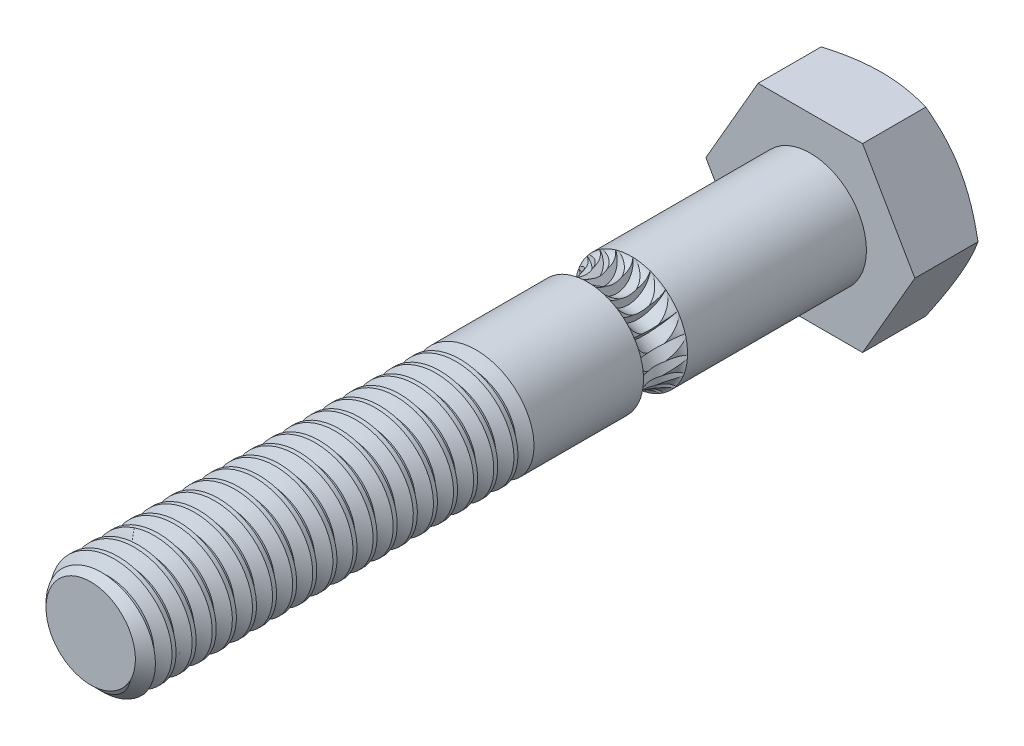
from build123d import *

# Parameters (mm, degrees)
SKETCH1_R             = 3.937
BOLT_BODY_DEPTH       = 50.5
BOLT_TIP_CHAMFER_SIZE = 0.8
CUT_SWEEP1_PITCH      = 1.411111111
BOLT_HEAD_DEPTH       = 5
SKETCH6_OUTSIDE_W     = 63.064
SKETCH6_OUTSIDE_H     = 61.1
SKETCH6_OUTSIDE_R     = 6.35
HEAD_CIRCLE_DEPTH     = 10
HEAD_CIRCLE_DRAFT     = -60
WAIST_CUT_CONTOUR_R   = 1.5875
TOOTH_CUT_CONTOUR_R   = 1.5875
TOOTH_CUT_DEPTH       = 52.601249437
TOOTH_X20_COUNT       = 20


with BuildPart() as part:
    # Sketch1 → Bolt Body (new body)
    with BuildSketch(Plane.XY):
        Circle(SKETCH1_R)
    extrude(amount=BOLT_BODY_DEPTH)

    # Bolt Tip Chamfer
    bolt_tip_chamfer_edges = [part.edges().sort_by_distance(p)[0] for p in [
        (-3.937, 0, 50.5),
    ]]
    chamfer(bolt_tip_chamfer_edges, length=BOLT_TIP_CHAMFER_SIZE)

    # Cut-Sweep1: arcs per turn and ends read off the stored shape
    # Cut-Sweep1: the profile of Sketch7 profile screwed along a right-hand helix through 20 turns, 8 arcs to a turn; built about Z, then put on its axis
    cut_sweep1_z = Axis((0, 0, 0), (0, 0, 1))
    cut_sweep1_corners = [(3.9373, 0, -0.352604573), (3.137, 0, -0.814657993), (3.137, 0, -1.019786451), (3.9373, 0, -1.481839872)]
    with BuildLine(mode=Mode.PRIVATE) as cut_sweep1_profile:
        Line(cut_sweep1_corners[0], cut_sweep1_corners[1])
        Line(cut_sweep1_corners[1], cut_sweep1_corners[2])
        Line(cut_sweep1_corners[2], cut_sweep1_corners[3])
        Line(cut_sweep1_corners[3], cut_sweep1_corners[0])
    cut_sweep1_cap = Face(cut_sweep1_profile.wire())
    cut_sweep1_turn_angles = [0, 22.5, 45, 67.5, 90, 112.5, 135, 157.5, 180, 202.5, 225, 247.5, 270, 292.5, 315, 337.5, 360]
    cut_sweep1_turn_weights = [1, 0.9238795325112867, 1, 0.9238795325112867, 1, 0.9238795325112867, 1, 0.9238795325112867, 1, 0.9238795325112867, 1, 0.9238795325112867, 1, 0.9238795325112867, 1, 0.9238795325112867, 1]
    cut_sweep1_turn_rails = [Edge.make_bspline([Vector(p[0], p[1], 0).rotate(cut_sweep1_z, cut_sweep1_turn_angles[k]) / cut_sweep1_turn_weights[k] + Vector(0, 0, p[2] + CUT_SWEEP1_PITCH * cut_sweep1_turn_angles[k] / 360) for k in range(17)], [0, 0, 0, 1, 1, 2, 2, 3, 3, 4, 4, 5, 5, 6, 6, 7, 7, 8, 8, 8], 2, cut_sweep1_turn_weights) for p in cut_sweep1_corners]
    cut_sweep1_turn_sides = [Face.make_surface_from_curves(cut_sweep1_turn_rails[p[0]], cut_sweep1_turn_rails[p[1]]) for p in [(0, 1), (1, 2), (2, 3), (3, 0)]]
    cut_sweep1 = Plane(origin=(0, 0, 50.5), x_dir=(-1, 0, 0), z_dir=(0, 0, -1)) * Solid(Shell([*[p.moved(Location((0, 0, CUT_SWEEP1_PITCH * i))) for i in range(20) for p in cut_sweep1_turn_sides], cut_sweep1_cap, cut_sweep1_cap.rotate(cut_sweep1_z, 7200).moved(Location((0, 0, CUT_SWEEP1_PITCH * 7200 / 360)))]))
    add(cut_sweep1, mode=Mode.SUBTRACT)

    # Sketch3 → Bolt Head (add)
    with BuildSketch(Plane.XY):
        Polygon((7.332348419, 0), (3.666174209, 6.35), (-3.666174209, 6.35), (-7.332348419, 0), (-3.666174209, -6.35), (3.666174209, -6.35), align=None)
    extrude(amount=-BOLT_HEAD_DEPTH)


with BuildPart() as head_circle_tool:
    # Sketch6 outside → Head Circle (with draft: the straight prism first)
    with BuildSketch(Plane(origin=(0, 0, -5), x_dir=(-1, 0, 0), z_dir=(0, 0, -1))):
        Rectangle(SKETCH6_OUTSIDE_W, SKETCH6_OUTSIDE_H)
        Circle(SKETCH6_OUTSIDE_R, mode=Mode.SUBTRACT)
    extrude(amount=-HEAD_CIRCLE_DEPTH)
    # Head Circle: the draft: its side faces are tilted about the plane it starts from
    head_circle_sides = [head_circle_tool.faces().sort_by_distance(p)[0] for p in [
        (0, -30.55, 0),
        (-31.532, 0, 0),
        (0, 30.55, 0),
        (31.532, 0, 0),
        (6.35, 0, 0),
    ]]
    draft(head_circle_sides, Plane(origin=(0, 0, -5), x_dir=(-1, 0, 0), z_dir=(0, 0, -1)), HEAD_CIRCLE_DRAFT)


with BuildPart() as part_1:
    add(part.part)

    # Head Circle: cut by head_circle_tool
    add(head_circle_tool.part, mode=Mode.SUBTRACT)

    # Waist Cut: sweep along a path in Waist Cut Path
    with BuildLine(Plane.XY.offset(14.1)) as waist_cut_path:
        CenterArc((0, 0), 4.174326293, 0, 360)
    # Waist Cut Contour → Waist Cut (sweep, cut)
    with BuildSketch(Plane(origin=(0, 3.05, 0), x_dir=(1, 0, 0), z_dir=(0, 1, 0))):
        with Locations((-2.85, -14.1)):
            Circle(WAIST_CUT_CONTOUR_R)
    sweep(path=waist_cut_path.line, mode=Mode.SUBTRACT)

    # Tooth Cut Contour → Tooth Cut (cut, through all)
    with BuildSketch(Plane(origin=(0, 1.31, 0), x_dir=(1, 0, 0), z_dir=(0, 1, 0))):
        with Locations((-4, -14.1)):
            Circle(TOOTH_CUT_CONTOUR_R)
    tooth_cut = extrude(amount=TOOTH_CUT_DEPTH, mode=Mode.SUBTRACT)

    # Tooth X20: Tooth Cut ×20 about axis
    tooth_x20_axis = Axis((0, 0, 0), (0, 0, 1))
    for i in range(1, TOOTH_X20_COUNT):
        add(tooth_cut.rotate(tooth_x20_axis, i * 360 / TOOTH_X20_COUNT), mode=Mode.SUBTRACT)


solid = part_1.part
